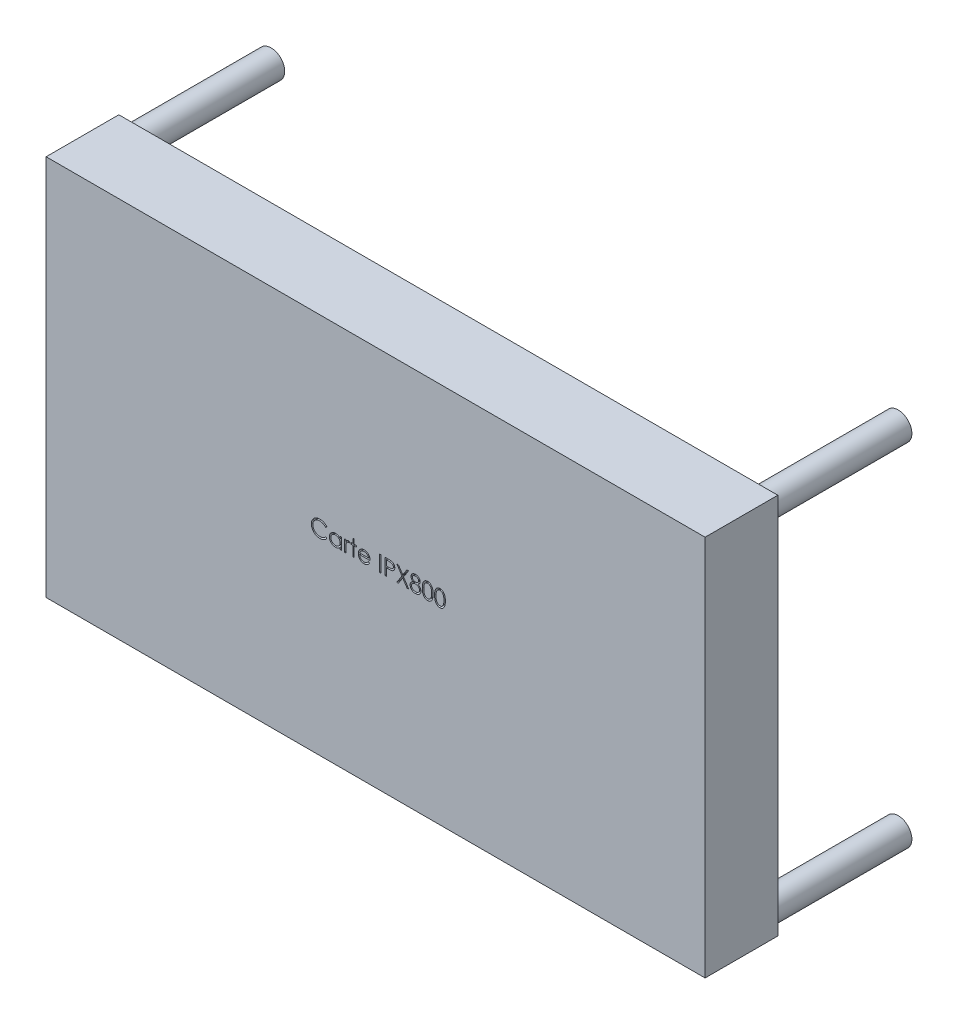
from build123d import *

# Parameters (mm, degrees)
ESQUISSE1_W          = 145
ESQUISSE1_H          = 84
EXTRUSION1_DEPTH     = 16
ESQUISSE2_R          = 3
EXTRUSION2_DEPTH     = 30
EXTRUSION3_START     = 14
EXTRUSION3_OUTLINE_W = 0.314102564
EXTRUSION3_OUTLINE_H = 3.5
EXTRUSION3_DEPTH     = 2


# Read off the part's stored shape, not the designer's step: Extrusion3
with BuildPart() as part:
    # Esquisse1 → Extrusion1 (new body)
    with BuildSketch(Plane.XY):
        with Locations((72.5, -42)):
            Rectangle(ESQUISSE1_W, ESQUISSE1_H)
    extrude(amount=EXTRUSION1_DEPTH)

    # Esquisse2 → Extrusion2 (add)
    with BuildSketch(Plane(origin=(0, 0, 0), x_dir=(-1, 0, 0), z_dir=(0, 0, -1))):
        with Locations(Location((-141.5, -3.5, 0), (0, 0, 180))):
            Circle(ESQUISSE2_R)
        with Locations(Location((-3.5, -3.5, 0), (0, 0, 180))):
            Circle(ESQUISSE2_R)
        with Locations(Location((-3.5, -80.5, 0), (0, 0, 180))):
            Circle(ESQUISSE2_R)
        with Locations(Location((-141.5, -80.807682255, 0), (0, 0, 180))):
            Circle(ESQUISSE2_R)
    extrude(amount=EXTRUSION2_DEPTH)

    # Extrusion3 outline → Extrusion3 (cut)
    # profile 1 of 11: a face of its own
    with BuildSketch(Plane.XY.offset(EXTRUSION3_START)):
        with BuildLine():
            add(Edge.make_bspline(
                [(60.256052199, -38.932405332), (60.296266671, -38.932887471), (60.375867168, -38.933841815), (60.49361982, -38.943147957), (60.608262147, -38.958661563), (60.719873129, -38.979777633), (60.828995745, -39.005984954), (60.934795986, -39.040125253), (61.037894673, -39.079161784), (61.137641581, -39.12412025), (61.233558132, -39.174586991), (61.32561445, -39.230002615), (61.413079309, -39.29029842), (61.496568157, -39.354961596), (61.574684368, -39.425360155), (61.649645847, -39.499557751), (61.718906925, -39.579691575), (61.76166012, -39.636096509), (61.783095468, -39.664376486)],
                knots=[0, 0, 0, 0, 0.068547537, 0.135682946, 0.20121499, 0.265682235, 0.329266835, 0.392395428, 0.455069762, 0.51712685, 0.578790035, 0.639739863, 0.700191504, 0.759806243, 0.819628319, 0.879354791, 0.939511608, 1, 1, 1, 1], degree=3))
            add(Edge.make_bspline(
                [(58.372839058, -40.75181639), (58.374394251, -40.688860937), (58.377453997, -40.565000012), (58.403449793, -40.383226059), (58.445268589, -40.20907466), (58.504665478, -40.042870915), (58.579970829, -39.883740635), (58.672997443, -39.73289943), (58.782664585, -39.589382631), (58.908112153, -39.455367879), (59.045679488, -39.332828527), (59.192998302, -39.225022323), (59.349780249, -39.135304807), (59.514298101, -39.060308644), (59.687783782, -39.002664181), (59.869867151, -38.962310995), (60.060206066, -38.937193878), (60.190068492, -38.93401867), (60.256052199, -38.932405332)],
                knots=[0, 0, 0, 0, 0.064557846, 0.127013532, 0.18795481, 0.248013913, 0.307747682, 0.368234515, 0.429469844, 0.492743437, 0.556257769, 0.618216786, 0.679655476, 0.741245546, 0.803415265, 0.866815462, 0.932328312, 1, 1, 1, 1], degree=3))
            add(Edge.make_bspline(
                [(58.816649154, -41.999813185), (58.78121351, -41.956271996), (58.710770033, -41.869715286), (58.62064435, -41.729429304), (58.543496795, -41.582961096), (58.481120874, -41.429541167), (58.432358141, -41.26951378), (58.398576946, -41.102798265), (58.376625341, -40.929550323), (58.374115052, -40.811713534), (58.372839058, -40.75181639)],
                knots=[0, 0, 0, 0, 0.12432851, 0.247156016, 0.368779749, 0.490733862, 0.613613772, 0.738957576, 0.867310575, 1, 1, 1, 1], degree=3))
            add(Edge.make_bspline(
                [(60.260258929, -42.611892512), (60.222615262, -42.611630519), (60.148179572, -42.611112462), (60.038280821, -42.602720294), (59.93129124, -42.591270557), (59.827516614, -42.574030426), (59.726390639, -42.553686086), (59.628830054, -42.526414829), (59.533874844, -42.495865663), (59.441906503, -42.459960676), (59.352846804, -42.419444494), (59.266982992, -42.373652935), (59.18435456, -42.32297107), (59.104149139, -42.26851606), (59.027551555, -42.208538758), (58.95389803, -42.143872123), (58.882775554, -42.074734112), (58.838772869, -42.024879259), (58.816649154, -41.999813185)],
                knots=[0, 0, 0, 0, 0.069662801, 0.137749562, 0.203916744, 0.268779862, 0.332413706, 0.39475354, 0.456180032, 0.516995649, 0.577395938, 0.637198344, 0.696999184, 0.756756194, 0.816553905, 0.876947997, 0.938131788, 1, 1, 1, 1], degree=3))
            add(Edge.make_bspline(
                [(61.783095468, -41.877817993), (61.760977358, -41.906356445), (61.716847083, -41.963296651), (61.645389066, -42.043568361), (61.570111768, -42.119072396), (61.490456058, -42.189200017), (61.407338267, -42.255354483), (61.319265954, -42.315656314), (61.227396922, -42.370947199), (61.132042443, -42.421574123), (61.03330383, -42.46649137), (60.931299395, -42.504945138), (60.82646882, -42.538070027), (60.718807311, -42.565321964), (60.608091554, -42.586593048), (60.49472108, -42.600812723), (60.378451205, -42.610554637), (60.300009784, -42.611442553), (60.260258929, -42.611892512)],
                knots=[0, 0, 0, 0, 0.061674239, 0.123053062, 0.183475001, 0.243726501, 0.304278917, 0.364862921, 0.425946204, 0.48739123, 0.549220384, 0.611143589, 0.67352853, 0.736961457, 0.800785283, 0.866012596, 0.932100748, 1, 1, 1, 1], degree=3))
            Line((61.783095468, -41.877817993), (61.508255724, -41.66958482))
            add(Edge.make_bspline(
                [(60.258155564, -42.252918153), (60.319258253, -42.251229373), (60.439522962, -42.247905451), (60.615890988, -42.219746202), (60.784726754, -42.174088284), (60.94603934, -42.110190361), (61.099373987, -42.027125073), (61.244970647, -41.926427196), (61.382952217, -41.807138863), (61.4659235, -41.716055735), (61.508255724, -41.66958482)],
                knots=[0, 0, 0, 0, 0.12851519, 0.252948636, 0.374754734, 0.495939754, 0.617180641, 0.740909469, 0.867811148, 1, 1, 1, 1], degree=3))
            add(Edge.make_bspline(
                [(58.686941622, -40.775654531), (58.688203441, -40.827385851), (58.690680855, -40.928953436), (58.712729189, -41.077724046), (58.74623428, -41.22024472), (58.796449857, -41.355624563), (58.858368908, -41.485532921), (58.936609519, -41.607771774), (59.027226057, -41.724188339), (59.131500476, -41.832031286), (59.245906292, -41.930545012), (59.368654204, -42.017295593), (59.499438492, -42.089610476), (59.636815122, -42.149786422), (59.781841236, -42.19604315), (59.934256038, -42.228607273), (60.093728033, -42.249849454), (60.202697433, -42.251883142), (60.258155564, -42.252918153)],
                knots=[0, 0, 0, 0, 0.064323217, 0.126290104, 0.186726469, 0.246146432, 0.305575643, 0.365429386, 0.426326309, 0.488839906, 0.551724972, 0.613918596, 0.675483766, 0.737333897, 0.800229044, 0.864502298, 0.931040739, 1, 1, 1, 1], degree=3))
            add(Edge.make_bspline(
                [(60.236420788, -39.291379691), (60.201337489, -39.291783654), (60.131496496, -39.29258783), (60.027848023, -39.303196955), (59.926134972, -39.318108165), (59.826423506, -39.340233488), (59.728840547, -39.368206107), (59.632748145, -39.401631521), (59.539537545, -39.442986361), (59.447919307, -39.488694621), (59.360140096, -39.540322066), (59.277085048, -39.596635418), (59.19905708, -39.657004514), (59.125994468, -39.721655621), (59.05782252, -39.790297581), (58.995035209, -39.863661923), (58.937849799, -39.941514096), (58.885132774, -40.022827504), (58.83792004, -40.107365295), (58.798390161, -40.195440366), (58.763385039, -40.285544469), (58.735685796, -40.37869563), (58.713761279, -40.474238395), (58.698633616, -40.572429183), (58.688145145, -40.673062863), (58.687344968, -40.741272176), (58.686941622, -40.775654531)],
                knots=[0, 0, 0, 0, 0.043954909, 0.087501875, 0.130462627, 0.172752021, 0.215403067, 0.25764983, 0.300152749, 0.34312149, 0.385925163, 0.427685727, 0.46881795, 0.5094918, 0.549883031, 0.589980023, 0.63040523, 0.670868626, 0.711383944, 0.751627258, 0.791775577, 0.832458919, 0.873319045, 0.914542956, 0.956923558, 1, 1, 1, 1], degree=3))
            add(Edge.make_bspline(
                [(61.508255724, -39.874713025), (61.488649836, -39.851347055), (61.449702389, -39.804930139), (61.387043187, -39.739750595), (61.321741544, -39.678685333), (61.253822422, -39.621443454), (61.182063303, -39.570026688), (61.108202504, -39.521755585), (61.031004459, -39.478487847), (60.924252724, -39.426024861), (60.784604876, -39.371278706), (60.608810037, -39.325375475), (60.425298939, -39.296154299), (60.300101339, -39.292989457), (60.236420788, -39.291379691)],
                knots=[0, 0, 0, 0, 0.063163259, 0.125474941, 0.18712122, 0.248294346, 0.309294856, 0.369850066, 0.430973376, 0.49245599, 0.616147966, 0.740843698, 0.868182649, 1, 1, 1, 1], degree=3))
            Line((61.508255724, -39.874713025), (61.783095468, -39.664376486))
        make_face()
    # profile 2 of 11: a face of its own
    with BuildSketch(Plane.XY.offset(EXTRUSION3_START)):
        with BuildLine():
            add(Edge.make_bspline(
                [(64.699762135, -42.07974107), (64.664343344, -42.119780664), (64.595223129, -42.197918435), (64.479782011, -42.300000607), (64.357413833, -42.384378929), (64.228712512, -42.452528844), (64.093794268, -42.503720901), (63.952958181, -42.54010706), (63.8061468, -42.563500895), (63.705894445, -42.565836917), (63.65509066, -42.567020717)],
                knots=[0, 0, 0, 0, 0.134298379, 0.262084975, 0.386269912, 0.507164597, 0.627300236, 0.748144942, 0.872370177, 1, 1, 1, 1], degree=3))
            Line((64.699762135, -42.07974107), (64.699762135, -42.522148922))
            Line((64.699762135, -42.522148922), (65.013864699, -42.522148922))
            Line((65.013864699, -42.522148922), (65.013864699, -39.964456614))
            Line((65.013864699, -39.964456614), (64.699762135, -39.964456614))
            Line((64.699762135, -39.964456614), (64.699762135, -40.437713826))
            add(Edge.make_bspline(
                [(63.664906365, -39.91958482), (63.717106224, -39.921022571), (63.819467684, -39.923841934), (63.969195694, -39.947304661), (64.110840172, -39.986943129), (64.245494524, -40.040860627), (64.37267521, -40.112509356), (64.491178194, -40.202889317), (64.602243677, -40.311430504), (64.666623969, -40.394800948), (64.699762135, -40.437713826)],
                knots=[0, 0, 0, 0, 0.129862142, 0.254653531, 0.376014554, 0.495255252, 0.614797719, 0.738105554, 0.8651963, 1, 1, 1, 1], degree=3))
            add(Edge.make_bspline(
                [(62.321557006, -41.23629155), (62.322809978, -41.191827847), (62.325287035, -41.103925503), (62.343740254, -40.974646806), (62.374771263, -40.850128545), (62.418319111, -40.730771602), (62.474161066, -40.616431551), (62.542089153, -40.507027526), (62.622108277, -40.402258129), (62.714360684, -40.304586902), (62.814295455, -40.214366288), (62.921204185, -40.135957242), (63.032427467, -40.068240394), (63.149690477, -40.014586917), (63.271257582, -39.971177813), (63.398211028, -39.941144845), (63.530022607, -39.923447523), (63.619513099, -39.920884759), (63.664906365, -39.91958482)],
                knots=[0, 0, 0, 0, 0.063774532, 0.12607881, 0.186904093, 0.247573935, 0.308003356, 0.369131898, 0.432033228, 0.496790794, 0.561610823, 0.624913866, 0.686726349, 0.748078833, 0.809582291, 0.871630743, 0.934885821, 1, 1, 1, 1], degree=3))
            add(Edge.make_bspline(
                [(63.65509066, -42.567020717), (63.609922706, -42.565794345), (63.520849501, -42.563375884), (63.389820424, -42.544613581), (63.263728175, -42.514482959), (63.142453602, -42.47258207), (63.026781457, -42.417001248), (62.91572136, -42.35046), (62.809848668, -42.27121917), (62.710777129, -42.180631142), (62.619545129, -42.082236154), (62.539483856, -41.977290607), (62.472730776, -41.866248304), (62.416910696, -41.75051515), (62.373914351, -41.62920023), (62.343940717, -41.502723062), (62.32520027, -41.371233189), (62.322782809, -41.281693666), (62.321557006, -41.23629155)],
                knots=[0, 0, 0, 0, 0.064619991, 0.127433484, 0.189004127, 0.249930071, 0.310668454, 0.372328961, 0.43493911, 0.499575544, 0.564191208, 0.626735217, 0.688109334, 0.749293607, 0.810330528, 0.87190117, 0.935045915, 1, 1, 1, 1], degree=3))
        make_face()
        with BuildLine():
            add(Edge.make_bspline(
                [(64.699762135, -41.248911743), (64.698802478, -41.213573912), (64.696913571, -41.144017879), (64.682483001, -41.041890361), (64.659528075, -40.944156635), (64.627181905, -40.850713946), (64.58469062, -40.762078931), (64.533442854, -40.677615171), (64.472537405, -40.597761959), (64.402954709, -40.523618888), (64.326789506, -40.455992426), (64.246194965, -40.395628185), (64.160216218, -40.346039412), (64.070299182, -40.304998141), (63.976287847, -40.272338991), (63.877417227, -40.250551297), (63.77473824, -40.235590976), (63.704692185, -40.234328596), (63.669113096, -40.233687384)],
                knots=[0, 0, 0, 0, 0.0656338, 0.129188088, 0.191218683, 0.251912818, 0.312507474, 0.373494434, 0.4351516, 0.498741474, 0.562095217, 0.624186567, 0.685475718, 0.746096815, 0.807611636, 0.869966581, 0.933951019, 1, 1, 1, 1], degree=3))
            add(Edge.make_bspline(
                [(63.666308609, -42.252918153), (63.711755112, -42.251258189), (63.802143698, -42.247956685), (63.935582406, -42.22267542), (64.065077369, -42.180906622), (64.188864597, -42.123007495), (64.304180728, -42.051250139), (64.407678606, -41.967243048), (64.495194574, -41.869539864), (64.569387184, -41.762163411), (64.627562601, -41.644451414), (64.66993866, -41.519117224), (64.694992566, -41.386156476), (64.698150295, -41.295292549), (64.699762135, -41.248911743)],
                knots=[0, 0, 0, 0, 0.084802388, 0.16866354, 0.252551924, 0.338239689, 0.423102661, 0.505556051, 0.586175656, 0.66713572, 0.74849918, 0.830452399, 0.913455706, 1, 1, 1, 1], degree=3))
            add(Edge.make_bspline(
                [(62.63565957, -41.239797159), (62.637524464, -41.283387267), (62.641246941, -41.370396622), (62.667997635, -41.499377199), (62.712877508, -41.625031241), (62.774119571, -41.746292235), (62.850806196, -41.858876335), (62.939694848, -41.960616458), (63.04164513, -42.048106046), (63.154572637, -42.12134362), (63.275180607, -42.18050614), (63.402014539, -42.22167178), (63.532690177, -42.248249561), (63.621542511, -42.251354037), (63.666308609, -42.252918153)],
                knots=[0, 0, 0, 0, 0.081589349, 0.162858895, 0.245483689, 0.330807139, 0.416493374, 0.499893203, 0.583048156, 0.667157852, 0.751311929, 0.833784789, 0.916256489, 1, 1, 1, 1], degree=3))
            add(Edge.make_bspline(
                [(63.669113096, -40.233687384), (63.623198758, -40.235321021), (63.532571158, -40.238545562), (63.399527156, -40.263719058), (63.272213742, -40.305603652), (63.151267668, -40.362885553), (63.038599451, -40.43491429), (62.93790578, -40.522035673), (62.848363079, -40.621872687), (62.773054815, -40.733974798), (62.711664318, -40.854152889), (62.668497286, -40.979777327), (62.640028038, -41.108582304), (62.637119518, -41.19594499), (62.63565957, -41.239797159)],
                knots=[0, 0, 0, 0, 0.085920517, 0.169593435, 0.252475515, 0.336244477, 0.419504521, 0.502035907, 0.584774648, 0.669846475, 0.754184866, 0.836658238, 0.918009726, 1, 1, 1, 1], degree=3))
        make_face(mode=Mode.SUBTRACT)
    # profile 3 of 11: a face of its own
    with BuildSketch(Plane.XY.offset(EXTRUSION3_START)):
        with BuildLine():
            add(Edge.make_bspline(
                [(65.956172391, -40.340959018), (65.97936115, -40.30590319), (66.023709471, -40.238859191), (66.0974224, -40.15018989), (66.172925731, -40.076774843), (66.250580919, -40.018271324), (66.330959018, -39.974458206), (66.41229597, -39.94236517), (66.49587144, -39.923387855), (66.552033364, -39.920854196), (66.580170788, -39.91958482)],
                knots=[0, 0, 0, 0, 0.160059412, 0.306112383, 0.438366514, 0.560541455, 0.675317225, 0.786113634, 0.892841788, 1, 1, 1, 1], degree=3))
            Line((65.956172391, -40.340959018), (65.956172391, -39.964456614))
            Line((65.956172391, -39.964456614), (65.642069827, -39.964456614))
            Line((65.642069827, -39.964456614), (65.642069827, -42.522148922))
            Line((65.642069827, -42.522148922), (65.956172391, -42.522148922))
            Line((65.956172391, -42.522148922), (65.956172391, -41.662573602))
            add(Edge.make_bspline(
                [(66.012262135, -40.784769114), (66.007529741, -40.805046288), (65.997047849, -40.849958687), (65.986856312, -40.925307211), (65.976786794, -41.01433087), (65.969690175, -41.117277463), (65.963112133, -41.233889907), (65.959402051, -41.364345853), (65.95629891, -41.508779204), (65.956215844, -41.609753557), (65.956172391, -41.662573602)],
                knots=[0, 0, 0, 0, 0.070854869, 0.15693815, 0.258600395, 0.37589093, 0.508166168, 0.656237809, 0.82017677, 1, 1, 1, 1], degree=3))
            add(Edge.make_bspline(
                [(66.520575436, -40.233687384), (66.495369702, -40.235367421), (66.443957312, -40.23879421), (66.368472813, -40.265733018), (66.295225607, -40.309258258), (66.237053945, -40.35752937), (66.192011692, -40.404077168), (66.159871467, -40.44472557), (66.13038872, -40.490304202), (66.102218499, -40.540033885), (66.076552205, -40.594763731), (66.052597536, -40.653946945), (66.030938673, -40.717652074), (66.018588429, -40.762034594), (66.012262135, -40.784769114)],
                knots=[0, 0, 0, 0, 0.093806529, 0.191338128, 0.295190617, 0.410312337, 0.471930251, 0.536425159, 0.603118728, 0.674117672, 0.749332023, 0.828283384, 0.912039809, 1, 1, 1, 1], degree=3))
            add(Edge.make_bspline(
                [(66.681132327, -40.2792603), (66.666023306, -40.272520034), (66.637343491, -40.259725719), (66.595388925, -40.244583709), (66.556707588, -40.235667793), (66.53206403, -40.234317075), (66.520575436, -40.233687384)],
                knots=[0, 0, 0, 0, 0.295138801, 0.560229945, 0.794983357, 1, 1, 1, 1], degree=3))
            Line((66.681132327, -40.2792603), (66.853608288, -40.007225044))
            add(Edge.make_bspline(
                [(66.580170788, -39.91958482), (66.601997115, -39.920775346), (66.6469062, -39.923224932), (66.71488879, -39.940435757), (66.784932242, -39.967913779), (66.830074629, -39.993754002), (66.853608288, -40.007225044)],
                knots=[0, 0, 0, 0, 0.225277548, 0.463523195, 0.720323555, 1, 1, 1, 1], degree=3))
        make_face()
    # profile 4 of 11: a face of its own
    with BuildSketch(Plane.XY.offset(EXTRUSION3_START)):
        with BuildLine():
            add(Edge.make_bspline(
                [(69.940647551, -42.252918153), (69.971998699, -42.252310096), (70.03420539, -42.251103595), (70.126846247, -42.239371684), (70.217985774, -42.220401409), (70.307246758, -42.194511419), (70.392817604, -42.162934567), (70.472063154, -42.124831709), (70.544943369, -42.082681962), (70.613060336, -42.034472287), (70.679131329, -41.9754641), (70.744673816, -41.901828379), (70.814950469, -41.814740851), (70.858940062, -41.749195185), (70.882254122, -41.714456614)],
                knots=[0, 0, 0, 0, 0.082592263, 0.163878894, 0.24565874, 0.327725695, 0.408609961, 0.485749086, 0.559169056, 0.630268476, 0.705306028, 0.792064966, 0.889796437, 1, 1, 1, 1], degree=3))
            add(Edge.make_bspline(
                [(69.007454442, -41.310610461), (69.008994049, -41.344310925), (69.012021623, -41.410581529), (69.026136766, -41.507552312), (69.04838554, -41.599925654), (69.079654602, -41.687008696), (69.117521447, -41.769938823), (69.163907164, -41.84810086), (69.219246718, -41.92113879), (69.280972418, -41.989705928), (69.349679513, -42.050766689), (69.42196226, -42.105418465), (69.498855825, -42.151224062), (69.579753909, -42.188403952), (69.664525694, -42.217510268), (69.753197889, -42.237378089), (69.845596005, -42.250685195), (69.908581739, -42.252164861), (69.940647551, -42.252918153)],
                knots=[0, 0, 0, 0, 0.068384615, 0.134475588, 0.198391058, 0.260753477, 0.321829223, 0.383037238, 0.444653123, 0.507398011, 0.569825238, 0.630777641, 0.690928687, 0.750945133, 0.811049477, 0.872330853, 0.935004094, 1, 1, 1, 1], degree=3))
            Line((69.007454442, -41.310610461), (71.295915981, -41.310610461))
            add(Edge.make_bspline(
                [(71.017570628, -40.422990268), (71.039697566, -40.45319385), (71.08380416, -40.513399968), (71.13905126, -40.611571126), (71.187008655, -40.71428172), (71.225341616, -40.823192017), (71.256381117, -40.937011597), (71.278837935, -41.056554142), (71.292007554, -41.181784053), (71.294596251, -41.267110609), (71.295915981, -41.310610461)],
                knots=[0, 0, 0, 0, 0.11852184, 0.236254763, 0.356174434, 0.477249655, 0.601539871, 0.729618382, 0.862158266, 1, 1, 1, 1], degree=3))
            add(Edge.make_bspline(
                [(69.987622711, -39.91958482), (70.040070317, -39.920938869), (70.142960563, -39.923595204), (70.292992684, -39.948221537), (70.4349534, -39.987274092), (70.568785905, -40.042427882), (70.694503765, -40.113587434), (70.811289815, -40.201729276), (70.921141327, -40.304147363), (70.985049906, -40.382910572), (71.017570628, -40.422990268)],
                knots=[0, 0, 0, 0, 0.132040234, 0.259032841, 0.381879824, 0.502258444, 0.62275219, 0.744742632, 0.870108927, 1, 1, 1, 1], degree=3))
            add(Edge.make_bspline(
                [(68.987823032, -40.39634764), (69.019530715, -40.35847877), (69.081941661, -40.28394062), (69.187498017, -40.186002294), (69.301798213, -40.103958519), (69.423409839, -40.035951382), (69.553746313, -39.984277736), (69.691055604, -39.945770153), (69.83690119, -39.924192142), (69.936606411, -39.921144309), (69.987622711, -39.91958482)],
                knots=[0, 0, 0, 0, 0.128835254, 0.253589335, 0.374643257, 0.495340042, 0.616324775, 0.739759335, 0.86684232, 1, 1, 1, 1], degree=3))
            add(Edge.make_bspline(
                [(68.693351878, -41.250313986), (68.694411019, -41.211019156), (68.696510098, -41.133141991), (68.709740885, -41.017876447), (68.733189178, -40.905847994), (68.765365502, -40.796963546), (68.806916748, -40.691405412), (68.857748967, -40.589109349), (68.917941345, -40.490184209), (68.964414019, -40.427781075), (68.987823032, -40.39634764)],
                knots=[0, 0, 0, 0, 0.128044808, 0.2537679, 0.377428427, 0.500550841, 0.623295883, 0.746578332, 0.872347541, 1, 1, 1, 1], degree=3))
            add(Edge.make_bspline(
                [(69.979910372, -42.567020717), (69.930768394, -42.565873542), (69.834906633, -42.563635735), (69.695366885, -42.544343271), (69.563987467, -42.512870912), (69.440775764, -42.46890537), (69.326033511, -42.411478046), (69.219532656, -42.341518564), (69.12071313, -42.25938631), (69.032688921, -42.164369866), (68.953445038, -42.062687909), (68.883519219, -41.956732025), (68.825061787, -41.8467688), (68.777509177, -41.733498276), (68.739104312, -41.617634382), (68.712337609, -41.498122915), (68.696907861, -41.375287331), (68.694543415, -41.292189995), (68.693351878, -41.250313986)],
                knots=[0, 0, 0, 0, 0.071578658, 0.139629225, 0.204796697, 0.268134963, 0.329813747, 0.391301398, 0.453433515, 0.51655169, 0.579631271, 0.641118921, 0.701294047, 0.760810336, 0.819931722, 0.878919575, 0.938982822, 1, 1, 1, 1], degree=3))
            add(Edge.make_bspline(
                [(71.161300596, -41.86099107), (71.139064001, -41.900434401), (71.095800392, -41.977175504), (71.021399644, -42.082607364), (70.943407572, -42.17745508), (70.858303604, -42.259184734), (70.768633925, -42.330436119), (70.67390127, -42.392773944), (70.573612452, -42.445892464), (70.467762728, -42.490644992), (70.355463176, -42.525054486), (70.23644166, -42.549358707), (70.110470165, -42.564381976), (70.024123985, -42.566127117), (69.979910372, -42.567020717)],
                knots=[0, 0, 0, 0, 0.093369857, 0.181660766, 0.265874227, 0.346354784, 0.424599862, 0.501903184, 0.579992091, 0.658443431, 0.738672236, 0.821894148, 0.908800792, 1, 1, 1, 1], degree=3))
            Line((71.161300596, -41.86099107), (70.882254122, -41.714456614))
        make_face()
        with BuildLine():
            add(Edge.make_bspline(
                [(69.344694026, -40.473471038), (69.328000744, -40.488565353), (69.294217609, -40.519112569), (69.249077088, -40.571741776), (69.205856615, -40.628493338), (69.166522962, -40.691538463), (69.130445376, -40.760159242), (69.096685399, -40.833776877), (69.066298987, -40.912950007), (69.049202877, -40.968122446), (69.040407167, -40.996507897)],
                knots=[0, 0, 0, 0, 0.109983845, 0.222580497, 0.338499871, 0.458708565, 0.585535346, 0.717517743, 0.85466682, 1, 1, 1, 1], degree=3))
            add(Edge.make_bspline(
                [(70.003748513, -40.233687384), (69.972399074, -40.234299055), (69.910427825, -40.235508201), (69.819126757, -40.246978331), (69.731447058, -40.265938176), (69.64674177, -40.291903132), (69.566120902, -40.326511735), (69.487926134, -40.367094961), (69.414145738, -40.416636545), (69.368004442, -40.4543954), (69.344694026, -40.473471038)],
                knots=[0, 0, 0, 0, 0.131091976, 0.259141276, 0.384161763, 0.505991952, 0.629098089, 0.750669123, 0.874038938, 1, 1, 1, 1], degree=3))
            add(Edge.make_bspline(
                [(70.981813417, -40.996507897), (70.970316792, -40.954845023), (70.948189491, -40.874657402), (70.901953126, -40.763616512), (70.849881585, -40.664928611), (70.788259854, -40.579348978), (70.718441128, -40.503345465), (70.637795946, -40.43692688), (70.547360052, -40.377509429), (70.447600912, -40.327356929), (70.341959126, -40.28466707), (70.231352935, -40.256041955), (70.118495147, -40.236432412), (70.04216086, -40.234606304), (70.003748513, -40.233687384)],
                knots=[0, 0, 0, 0, 0.096240125, 0.185231261, 0.267500523, 0.344400382, 0.419594869, 0.496890627, 0.576637919, 0.660267852, 0.745386615, 0.830040327, 0.914474212, 1, 1, 1, 1], degree=3))
            Line((70.981813417, -40.996507897), (69.040407167, -40.996507897))
        make_face(mode=Mode.SUBTRACT)
    # profile 5 of 11: a face of its own
    with BuildSketch(Plane.XY.offset(EXTRUSION3_START)):
        with BuildLine():
            add(Edge.make_bspline(
                [(75.257955243, -39.022148922), (75.30516615, -39.022200818), (75.395624342, -39.022300254), (75.525339398, -39.025315), (75.64314913, -39.029341692), (75.748799511, -39.034923585), (75.842615609, -39.041520175), (75.924172908, -39.050772215), (75.994112465, -39.06043251), (76.036018914, -39.070253917), (76.055130724, -39.074733057)],
                knots=[0, 0, 0, 0, 0.176955752, 0.33905508, 0.486318225, 0.618780923, 0.735618828, 0.838742477, 0.926457068, 1, 1, 1, 1], degree=3))
            Line((75.257955243, -39.022148922), (74.571557006, -39.022148922))
            Line((74.571557006, -39.022148922), (74.571557006, -42.522148922))
            Line((74.571557006, -42.522148922), (74.88565957, -42.522148922))
            Line((74.88565957, -42.522148922), (74.88565957, -40.906764307))
            Line((74.88565957, -40.906764307), (75.135960051, -40.906764307))
            add(Edge.make_bspline(
                [(76.027085852, -40.84927232), (76.005158518, -40.853935301), (75.957103491, -40.864154495), (75.877960769, -40.875562952), (75.785815383, -40.885300552), (75.680793103, -40.89260169), (75.562988198, -40.898852058), (75.432336941, -40.903820152), (75.288582864, -40.906550006), (75.18831162, -40.906690799), (75.135960051, -40.906764307)],
                knots=[0, 0, 0, 0, 0.075173117, 0.164746258, 0.268016881, 0.385911876, 0.517789479, 0.663690977, 0.824413221, 1, 1, 1, 1], degree=3))
            add(Edge.make_bspline(
                [(76.72540316, -39.960951006), (76.724981735, -39.989728782), (76.724157189, -40.046034446), (76.714260904, -40.128407234), (76.700930713, -40.207125625), (76.68043366, -40.282015075), (76.653587987, -40.352630846), (76.622095934, -40.420052078), (76.584112404, -40.483131749), (76.540467574, -40.542098867), (76.49191598, -40.597008779), (76.438663042, -40.647463574), (76.380923749, -40.693167912), (76.318881601, -40.734224256), (76.251931752, -40.769680535), (76.181089599, -40.80143784), (76.105739382, -40.828108901), (76.053596868, -40.842138962), (76.027085852, -40.84927232)],
                knots=[0, 0, 0, 0, 0.070118894, 0.137192353, 0.202016181, 0.264631407, 0.326116547, 0.386010305, 0.445811847, 0.505297697, 0.564633278, 0.624282625, 0.683902032, 0.743952771, 0.805387731, 0.868388031, 0.933084028, 1, 1, 1, 1], degree=3))
            add(Edge.make_bspline(
                [(76.055130724, -39.074733057), (76.079324258, -39.081355007), (76.127141235, -39.094442868), (76.196042278, -39.120656592), (76.261596124, -39.151738757), (76.324027682, -39.187162697), (76.382569765, -39.228448261), (76.438095806, -39.273921879), (76.490115787, -39.324633447), (76.538337179, -39.380014187), (76.582621976, -39.439134397), (76.620751659, -39.502876627), (76.652678886, -39.57016793), (76.680062157, -39.640961502), (76.699770612, -39.715851825), (76.714617512, -39.794318537), (76.724041139, -39.876353228), (76.724943701, -39.932413095), (76.72540316, -39.960951006)],
                knots=[0, 0, 0, 0, 0.062481339, 0.123490383, 0.183411094, 0.243153221, 0.302126735, 0.361709671, 0.421842292, 0.482931901, 0.544552254, 0.60568072, 0.667679738, 0.729984388, 0.794550921, 0.86034562, 0.928907356, 1, 1, 1, 1], degree=3))
        make_face()
        with BuildLine():
            add(Edge.make_bspline(
                [(76.411300596, -39.962353249), (76.41003795, -39.934214736), (76.407527965, -39.878278854), (76.388872101, -39.796300093), (76.357522788, -39.718064389), (76.314066193, -39.645091303), (76.261325063, -39.578902499), (76.20002572, -39.521405372), (76.130312459, -39.475183669), (76.065464228, -39.445350388), (76.007863042, -39.427135112), (75.957831082, -39.414390272), (75.901340407, -39.404214666), (75.838372628, -39.395975163), (75.769415794, -39.388921702), (75.693877479, -39.384135724), (75.612043836, -39.381334268), (75.555233265, -39.381195313), (75.525783769, -39.381123281)],
                knots=[0, 0, 0, 0, 0.070043755, 0.139238317, 0.208197455, 0.279173374, 0.349986812, 0.418353846, 0.487609584, 0.557411073, 0.595330157, 0.637964052, 0.685912778, 0.738185165, 0.796102647, 0.858516544, 0.926657726, 1, 1, 1, 1], degree=3))
            add(Edge.make_bspline(
                [(75.498440019, -40.555502288), (75.528359945, -40.555517751), (75.586119745, -40.555547603), (75.669555968, -40.55156238), (75.746965255, -40.546961847), (75.818109831, -40.540225924), (75.883021765, -40.530704666), (75.941809294, -40.521092928), (75.994016577, -40.507187566), (76.055115779, -40.488464497), (76.123199126, -40.456531881), (76.197266675, -40.410181991), (76.260037261, -40.351101283), (76.314355558, -40.284673451), (76.357461436, -40.210774322), (76.389017428, -40.131705385), (76.407558586, -40.048277536), (76.410044779, -39.991189397), (76.411300596, -39.962353249)],
                knots=[0, 0, 0, 0, 0.072538371, 0.140033831, 0.202495681, 0.260575056, 0.313228338, 0.361583194, 0.404878361, 0.444127437, 0.516399693, 0.586506671, 0.655085374, 0.724383783, 0.793973529, 0.861637682, 0.930110942, 1, 1, 1, 1], degree=3))
            Line((75.498440019, -40.555502288), (74.88565957, -40.547789948))
            Line((74.88565957, -40.547789948), (74.88565957, -39.381123281))
            Line((74.88565957, -39.381123281), (75.525783769, -39.381123281))
        make_face(mode=Mode.SUBTRACT)
    # profile 6 of 11: a face of its own
    with BuildSketch(Plane.XY.offset(EXTRUSION3_START)):
        with BuildLine():
            add(Edge.make_bspline(
                [(82.289505724, -39.840358057), (82.288071164, -39.878334721), (82.285253768, -39.95291873), (82.261553829, -40.06164525), (82.221640515, -40.163467289), (82.167146352, -40.259540242), (82.096120864, -40.348121739), (82.009512131, -40.430338209), (81.908010653, -40.506865037), (81.831749767, -40.550051402), (81.792410372, -40.572329211)],
                knots=[0, 0, 0, 0, 0.121904041, 0.239412608, 0.355410104, 0.472090729, 0.592858982, 0.718703468, 0.854892383, 1, 1, 1, 1], degree=3))
            add(Edge.make_bspline(
                [(81.296016141, -38.932405332), (81.340519956, -38.933851676), (81.428276409, -38.936703699), (81.557271037, -38.960490577), (81.680695914, -39.000220097), (81.798125413, -39.054117321), (81.90745728, -39.120504261), (82.00405959, -39.200905135), (82.089392172, -39.291046686), (82.159976566, -39.391966289), (82.218139455, -39.498650483), (82.258640356, -39.610273004), (82.28459233, -39.724422063), (82.287865695, -39.801660067), (82.289505724, -39.840358057)],
                knots=[0, 0, 0, 0, 0.089409711, 0.176305764, 0.262625902, 0.349445726, 0.435498264, 0.51892813, 0.601354657, 0.684256422, 0.76580674, 0.844876866, 0.922279795, 1, 1, 1, 1], degree=3))
            add(Edge.make_bspline(
                [(80.270274955, -39.830542352), (80.271910379, -39.793244793), (80.275197867, -39.718270196), (80.301781187, -39.606664073), (80.345101254, -39.497047508), (80.404022251, -39.389951795), (80.477409467, -39.289001581), (80.565456013, -39.198460634), (80.66605931, -39.119149152), (80.778717177, -39.052572979), (80.899953412, -38.99838932), (81.027869136, -38.961010897), (81.160235629, -38.936574781), (81.250333349, -38.933808126), (81.296016141, -38.932405332)],
                knots=[0, 0, 0, 0, 0.074058426, 0.148870352, 0.226667668, 0.307734759, 0.391157204, 0.473929356, 0.557927752, 0.64498929, 0.733364056, 0.821092042, 0.909287215, 1, 1, 1, 1], degree=3))
            add(Edge.make_bspline(
                [(80.781392743, -40.572329211), (80.740801369, -40.550194442), (80.662205106, -40.507335334), (80.558135665, -40.428588528), (80.468745041, -40.343300714), (80.396490324, -40.249670919), (80.339618096, -40.150624044), (80.300599491, -40.046779792), (80.274203007, -39.940063679), (80.27158818, -39.867157482), (80.270274955, -39.830542352)],
                knots=[0, 0, 0, 0, 0.14586006, 0.282425903, 0.4108504, 0.535029421, 0.654701078, 0.770133433, 0.884555844, 1, 1, 1, 1], degree=3))
            add(Edge.make_bspline(
                [(80.090787776, -41.531463826), (80.091365657, -41.506904634), (80.092507753, -41.458367002), (80.100412602, -41.386657674), (80.113121063, -41.316861539), (80.13038052, -41.248720795), (80.153771546, -41.182731523), (80.182013679, -41.118581049), (80.214945632, -41.05619695), (80.253026797, -40.995238069), (80.297328821, -40.936558557), (80.347492471, -40.879162562), (80.404520339, -40.823940695), (80.467777998, -40.77021827), (80.536542538, -40.717042296), (80.612600068, -40.667286568), (80.693934336, -40.617428603), (80.751739742, -40.587620278), (80.781392743, -40.572329211)],
                knots=[0, 0, 0, 0, 0.058853586, 0.116315459, 0.172674843, 0.228780387, 0.284580359, 0.340256506, 0.396629805, 0.453507263, 0.51231819, 0.572648444, 0.636021936, 0.702362946, 0.771483056, 0.844184477, 0.920069794, 1, 1, 1, 1], degree=3))
            add(Edge.make_bspline(
                [(81.274982487, -42.611892512), (81.227969098, -42.610740034), (81.136485819, -42.608497429), (81.003327942, -42.593302997), (80.879204872, -42.566675131), (80.763394904, -42.530230521), (80.65659621, -42.482820293), (80.559113109, -42.423811884), (80.469539137, -42.355580442), (80.390592663, -42.276166364), (80.32050422, -42.191108492), (80.258936167, -42.103356882), (80.207762088, -42.012903524), (80.164434993, -41.921097157), (80.13126697, -41.826651003), (80.10829476, -41.73005099), (80.093705446, -41.631465847), (80.091764311, -41.564934194), (80.090787776, -41.531463826)],
                knots=[0, 0, 0, 0, 0.078556433, 0.15286284, 0.223559693, 0.290374944, 0.355403073, 0.418291157, 0.480388564, 0.543072615, 0.604923944, 0.664398309, 0.721942555, 0.778374891, 0.833829941, 0.888861236, 0.94408894, 1, 1, 1, 1], degree=3))
            add(Edge.make_bspline(
                [(82.203968865, -42.227677768), (82.176132391, -42.258271543), (82.120803425, -42.319081035), (82.026020498, -42.398031845), (81.921998614, -42.464381239), (81.809140281, -42.518453134), (81.68774718, -42.560538993), (81.557845175, -42.590781511), (81.419181022, -42.60810394), (81.323875551, -42.61060793), (81.274982487, -42.611892512)],
                knots=[0, 0, 0, 0, 0.11928345, 0.237092882, 0.354796044, 0.474576301, 0.597460066, 0.724926155, 0.858883199, 1, 1, 1, 1], degree=3))
            add(Edge.make_bspline(
                [(82.468992904, -41.502717832), (82.468221483, -41.536415565), (82.466694553, -41.603116022), (82.453394568, -41.701562133), (82.43348159, -41.797173915), (82.404402078, -41.889930406), (82.366688687, -41.979319779), (82.320211851, -42.065418553), (82.267600646, -42.149637862), (82.225348407, -42.201457264), (82.203968865, -42.227677768)],
                knots=[0, 0, 0, 0, 0.128158186, 0.253673136, 0.377325306, 0.499384555, 0.622918368, 0.745839393, 0.871395285, 1, 1, 1, 1], degree=3))
            add(Edge.make_bspline(
                [(81.792410372, -40.572329211), (81.821058919, -40.587267167), (81.876933153, -40.61640117), (81.956510362, -40.663311997), (82.029235363, -40.712752962), (82.097125925, -40.762388821), (82.158989276, -40.814120473), (82.214133688, -40.868153629), (82.263921308, -40.923139574), (82.307348092, -40.980009415), (82.345544929, -41.038612064), (82.378557064, -41.099101337), (82.406774267, -41.16134467), (82.429137206, -41.2260215), (82.447558997, -41.292181762), (82.460234602, -41.360679744), (82.46705152, -41.431064085), (82.468340334, -41.478632386), (82.468992904, -41.502717832)],
                knots=[0, 0, 0, 0, 0.07952483, 0.155099976, 0.22721982, 0.295910504, 0.362055881, 0.425520117, 0.485812719, 0.544494706, 0.601459636, 0.657840594, 0.713974472, 0.769467952, 0.826129967, 0.882885359, 0.940700882, 1, 1, 1, 1], degree=3))
        make_face()
        with BuildLine():
            add(Edge.make_bspline(
                [(82.15489034, -41.509027929), (82.153984491, -41.485150588), (82.152198316, -41.438068643), (82.140861625, -41.368302117), (82.120945748, -41.300899302), (82.093618351, -41.235049297), (82.057237388, -41.172086346), (82.014392518, -41.110370174), (81.962698399, -41.05161373), (81.904285803, -40.995360634), (81.840626842, -40.943344897), (81.772959698, -40.897330459), (81.701805236, -40.858578342), (81.627314025, -40.827061847), (81.549651469, -40.802274377), (81.46887469, -40.784958382), (81.384889115, -40.774058779), (81.327834245, -40.772792733), (81.298820628, -40.772148922)],
                knots=[0, 0, 0, 0, 0.057339426, 0.113063332, 0.169181449, 0.22577456, 0.283826304, 0.343454279, 0.405906962, 0.47139226, 0.538002834, 0.603063556, 0.667601831, 0.732225443, 0.79700481, 0.86304799, 0.930356987, 1, 1, 1, 1], degree=3))
            add(Edge.make_bspline(
                [(81.278488096, -42.252918153), (81.311238464, -42.252289345), (81.375046683, -42.251064224), (81.468132632, -42.24024993), (81.55597718, -42.223100305), (81.638409979, -42.198156759), (81.716353819, -42.167706783), (81.788487173, -42.128534701), (81.8566657, -42.083982378), (81.917529823, -42.031124222), (81.972963031, -41.974644727), (82.021296324, -41.914854684), (82.063253875, -41.853379051), (82.096184831, -41.788828567), (82.122511084, -41.722441652), (82.141434639, -41.653606141), (82.153110854, -41.582110908), (82.15429175, -41.533611837), (82.15489034, -41.509027929)],
                knots=[0, 0, 0, 0, 0.076558933, 0.149161352, 0.218826846, 0.285567139, 0.350313106, 0.414125154, 0.477179161, 0.540368019, 0.60220239, 0.662033654, 0.719934407, 0.775907433, 0.831114864, 0.886667447, 0.942552362, 1, 1, 1, 1], degree=3))
            add(Edge.make_bspline(
                [(80.40489034, -41.541980653), (80.406253598, -41.573411559), (80.408958272, -41.635769742), (80.430414911, -41.727932814), (80.464850446, -41.817153869), (80.512875662, -41.902705821), (80.572343235, -41.982655928), (80.645469703, -42.052344703), (80.727710541, -42.114266182), (80.821848395, -42.164346715), (80.924676861, -42.20434157), (81.03616859, -42.231897533), (81.154723508, -42.250138983), (81.2365831, -42.251977164), (81.278488096, -42.252918153)],
                knots=[0, 0, 0, 0, 0.074898208, 0.148596294, 0.224471235, 0.302322742, 0.381918618, 0.461148696, 0.542417123, 0.626716083, 0.714596831, 0.80490292, 0.900127254, 1, 1, 1, 1], degree=3))
            add(Edge.make_bspline(
                [(81.298820628, -40.772148922), (81.267694843, -40.772702564), (81.206633646, -40.773788673), (81.117176718, -40.785878173), (81.031323552, -40.802707566), (80.949363616, -40.828238405), (80.871331519, -40.861434895), (80.796804837, -40.901369435), (80.726353707, -40.948574878), (80.660950981, -41.002451494), (80.601227651, -41.060510948), (80.548829351, -41.121973083), (80.504331831, -41.185695616), (80.46849858, -41.252487845), (80.439086848, -41.320935456), (80.419772971, -41.392743051), (80.407391259, -41.466530164), (80.405728627, -41.516690263), (80.40489034, -41.541980653)],
                knots=[0, 0, 0, 0, 0.071268693, 0.139811785, 0.206497432, 0.271535244, 0.336081831, 0.400528388, 0.464983843, 0.530050305, 0.594423409, 0.65558271, 0.714849106, 0.772115064, 0.828999211, 0.885122163, 0.942079353, 1, 1, 1, 1], degree=3))
        make_face(mode=Mode.SUBTRACT)
        with BuildLine():
            add(Edge.make_bspline(
                [(81.97540316, -39.828438986), (81.974871263, -39.81181095), (81.973815522, -39.778806682), (81.965115466, -39.730068317), (81.950739633, -39.682438734), (81.931276553, -39.635524463), (81.905666758, -39.589983731), (81.875302571, -39.545100643), (81.838418069, -39.501884879), (81.797021636, -39.45932933), (81.750076227, -39.419945307), (81.697672315, -39.385310597), (81.640078565, -39.35589824), (81.577293615, -39.332009485), (81.509548691, -39.314067136), (81.437155816, -39.300630788), (81.359511369, -39.293057676), (81.306081618, -39.291951151), (81.278488096, -39.291379691)],
                knots=[0, 0, 0, 0, 0.050902438, 0.101034043, 0.151083817, 0.203061988, 0.256248434, 0.310846715, 0.3687691, 0.43001504, 0.492519647, 0.556048722, 0.621995683, 0.690192369, 0.761384855, 0.83635622, 0.915487005, 1, 1, 1, 1], degree=3))
            add(Edge.make_bspline(
                [(81.291108288, -40.413174563), (81.320858392, -40.412301696), (81.38006476, -40.410564583), (81.467344091, -40.394413409), (81.552206736, -40.369007492), (81.63374564, -40.334247525), (81.709850225, -40.290619665), (81.777690294, -40.238386647), (81.836687187, -40.17875455), (81.886227797, -40.112651714), (81.924637643, -40.042300126), (81.954539451, -39.971699833), (81.972000666, -39.900097602), (81.974278233, -39.852130638), (81.97540316, -39.828438986)],
                knots=[0, 0, 0, 0, 0.089689936, 0.17849401, 0.266837753, 0.356558176, 0.44533425, 0.530805835, 0.614076217, 0.697707086, 0.77914195, 0.855353591, 0.92855682, 1, 1, 1, 1], degree=3))
            add(Edge.make_bspline(
                [(80.584377519, -39.835450204), (80.585064886, -39.853730714), (80.586423222, -39.889855627), (80.59692835, -39.943201493), (80.612585205, -39.995623129), (80.637235866, -40.04587404), (80.666802224, -40.0956974), (80.7032937, -40.143847986), (80.746782728, -40.190493371), (80.795810169, -40.235236812), (80.849221706, -40.277135575), (80.90580575, -40.313508756), (80.964852141, -40.343942867), (81.02575421, -40.369272272), (81.089132658, -40.388962209), (81.154599131, -40.402930855), (81.222164633, -40.411612852), (81.267945214, -40.412649873), (81.291108288, -40.413174563)],
                knots=[0, 0, 0, 0, 0.05456395, 0.107826203, 0.161923709, 0.217509701, 0.274498333, 0.334814765, 0.397554947, 0.464754577, 0.53290121, 0.600097214, 0.665354161, 0.731083628, 0.796883494, 0.86329159, 0.930831218, 1, 1, 1, 1], degree=3))
            add(Edge.make_bspline(
                [(81.278488096, -39.291379691), (81.25393729, -39.292031132), (81.205905179, -39.293305635), (81.135476508, -39.299964272), (81.068504141, -39.312917488), (81.00428834, -39.3301562), (80.943709528, -39.353444188), (80.885944973, -39.380839197), (80.831977783, -39.414145263), (80.78115648, -39.451506461), (80.735405706, -39.492599367), (80.694801154, -39.535413086), (80.66107304, -39.580788478), (80.632431931, -39.627596837), (80.611650413, -39.677227414), (80.596086109, -39.72815859), (80.585564718, -39.781033974), (80.584776328, -39.817170485), (80.584377519, -39.835450204)],
                knots=[0, 0, 0, 0, 0.075243309, 0.147208812, 0.21644709, 0.284025042, 0.350655449, 0.415031318, 0.479629831, 0.544651634, 0.60804424, 0.667827565, 0.725114247, 0.780991708, 0.835527004, 0.889438155, 0.944072089, 1, 1, 1, 1], degree=3))
        make_face(mode=Mode.SUBTRACT)
    # profile 7 of 11: a face of its own
    with BuildSketch(Plane.XY.offset(EXTRUSION3_START)):
        with BuildLine():
            add(Edge.make_bspline(
                [(83.953267743, -42.611892512), (83.92566363, -42.611426156), (83.871233705, -42.610506595), (83.790581279, -42.600992863), (83.712298836, -42.58569736), (83.636000082, -42.564280756), (83.561293567, -42.538065919), (83.48919728, -42.503912236), (83.418909596, -42.464578167), (83.35061804, -42.419782745), (83.285605879, -42.368461062), (83.223507274, -42.311696774), (83.165882255, -42.248073362), (83.112248159, -42.178595439), (83.061274071, -42.103902197), (83.014384698, -42.022973824), (82.971013844, -41.936131213), (82.931370353, -41.842813303), (82.89622169, -41.741658375), (82.865173981, -41.631509196), (82.840659824, -41.51139356), (82.819676869, -41.382276193), (82.802752486, -41.243602263), (82.79119816, -41.095296485), (82.784056845, -40.937451276), (82.783421775, -40.829181501), (82.783095468, -40.773551166)],
                knots=[0, 0, 0, 0, 0.033787146, 0.066621658, 0.099284878, 0.131361165, 0.163585188, 0.196103927, 0.228902254, 0.262158056, 0.295991222, 0.330217846, 0.365059826, 0.400950737, 0.437620382, 0.475707529, 0.515380692, 0.556413541, 0.59976483, 0.646424156, 0.696431445, 0.749781518, 0.806573307, 0.867435532, 0.931886753, 1, 1, 1, 1], degree=3))
            add(Edge.make_bspline(
                [(85.161300596, -40.773551166), (85.160649012, -40.827075074), (85.159379426, -40.931364226), (85.152800719, -41.083895201), (85.139842088, -41.227893244), (85.123632099, -41.363703707), (85.101181136, -41.490761325), (85.07357597, -41.609505774), (85.042925647, -41.720449846), (85.005090853, -41.822684657), (84.963680143, -41.91763638), (84.918624947, -42.006303528), (84.870355121, -42.089469821), (84.817766376, -42.166469568), (84.761712962, -42.237848225), (84.700995174, -42.302345848), (84.637324588, -42.36151652), (84.569912173, -42.414168147), (84.499500621, -42.460252952), (84.427541544, -42.501466802), (84.352758161, -42.534699497), (84.276845208, -42.563234538), (84.198716842, -42.58503499), (84.118470452, -42.600108846), (84.036514216, -42.610680694), (83.981112651, -42.611487174), (83.953267743, -42.611892512)],
                knots=[0, 0, 0, 0, 0.06506329, 0.126773166, 0.185515763, 0.240764679, 0.292979796, 0.342250373, 0.388919286, 0.432775664, 0.474628433, 0.514774691, 0.553605893, 0.591426406, 0.62802812, 0.663803634, 0.698984336, 0.733591489, 0.767628469, 0.801208348, 0.83426384, 0.866980695, 0.899719742, 0.932701912, 0.966175883, 1, 1, 1, 1], degree=3))
            add(Edge.make_bspline(
                [(83.953267743, -38.932405332), (83.981103222, -38.932893148), (84.036459231, -38.933863259), (84.118299606, -38.943187201), (84.198249288, -38.958658324), (84.275967427, -38.980579299), (84.352092413, -39.007774975), (84.426028821, -39.041862093), (84.498235902, -39.08154096), (84.56756619, -39.128164837), (84.634780805, -39.180147113), (84.698228768, -39.238909782), (84.757915854, -39.303859501), (84.814591159, -39.374301365), (84.866646757, -39.45158645), (84.916220189, -39.53437056), (84.960592225, -39.624101425), (85.0033269, -39.719281893), (85.040213887, -39.822545551), (85.073480132, -39.933310312), (85.100359101, -40.052884499), (85.122748373, -40.180640744), (85.140093269, -40.317048227), (85.152725911, -40.461814543), (85.159398996, -40.615034933), (85.160655697, -40.719792783), (85.161300596, -40.773551166)],
                knots=[0, 0, 0, 0, 0.033788116, 0.067193932, 0.099862411, 0.132566612, 0.165151173, 0.197913187, 0.231319004, 0.265083278, 0.299255309, 0.334398567, 0.369942824, 0.406283561, 0.44406382, 0.482997707, 0.523354447, 0.56553659, 0.609612924, 0.656390811, 0.705885495, 0.7583245, 0.813831783, 0.872794559, 0.93472223, 1, 1, 1, 1], degree=3))
            add(Edge.make_bspline(
                [(82.783095468, -40.773551166), (82.783423486, -40.717453778), (82.784060666, -40.608483794), (82.791149087, -40.449699152), (82.802924429, -40.300738863), (82.819061802, -40.161595797), (82.838699782, -40.032234032), (82.864915269, -39.912999275), (82.894728072, -39.803339668), (82.929280517, -39.70289762), (82.968268306, -39.610319917), (83.010702567, -39.523894716), (83.058267362, -39.443752783), (83.108244274, -39.368614993), (83.162656346, -39.299711298), (83.219955137, -39.236068636), (83.282377013, -39.179157885), (83.347800021, -39.127311583), (83.416816485, -39.081862111), (83.487459152, -39.041829372), (83.560214257, -39.007629505), (83.63528044, -38.980739069), (83.711982998, -38.958528223), (83.790590065, -38.943339275), (83.871231429, -38.933782366), (83.925662864, -38.932868699), (83.953267743, -38.932405332)],
                knots=[0, 0, 0, 0, 0.068594622, 0.133246042, 0.194312586, 0.251279223, 0.304513439, 0.354234907, 0.400480589, 0.443410755, 0.484014869, 0.523252301, 0.561042373, 0.597900239, 0.633518489, 0.668314351, 0.702495671, 0.736685354, 0.770293169, 0.803437255, 0.835912952, 0.868460246, 0.900846538, 0.933466525, 0.966257575, 1, 1, 1, 1], degree=3))
        make_face()
        with BuildLine():
            add(Edge.make_bspline(
                [(83.96378457, -39.291379691), (83.925073978, -39.293411138), (83.847582273, -39.297477732), (83.733134318, -39.326170986), (83.623429966, -39.376183952), (83.536186992, -39.431136324), (83.469323205, -39.483474636), (83.422240512, -39.52886109), (83.37809434, -39.578507344), (83.337426639, -39.632909259), (83.299337356, -39.691374626), (83.264356344, -39.754363391), (83.232839014, -39.822194755), (83.203754478, -39.894811191), (83.17818169, -39.974392135), (83.157087727, -40.062161129), (83.137600673, -40.15862302), (83.123805405, -40.264342528), (83.111541649, -40.378624682), (83.103660301, -40.501902), (83.097529043, -40.63396638), (83.097310579, -40.725165539), (83.097198032, -40.772148922)],
                knots=[0, 0, 0, 0, 0.060386619, 0.120883249, 0.182754619, 0.24781103, 0.2812991, 0.315087624, 0.349702396, 0.384856581, 0.420966197, 0.458511188, 0.497174722, 0.537602048, 0.580503018, 0.62746754, 0.67838821, 0.733983221, 0.793746705, 0.857713672, 0.926697864, 1, 1, 1, 1], degree=3))
            add(Edge.make_bspline(
                [(84.847198032, -40.772148922), (84.846647843, -40.73008135), (84.845571555, -40.647788185), (84.841457567, -40.527270004), (84.830833993, -40.412802243), (84.819034874, -40.303891771), (84.801637653, -40.201141468), (84.782879846, -40.103691163), (84.757678634, -40.012748138), (84.730758859, -39.926888556), (84.699948463, -39.847087902), (84.666032729, -39.772974115), (84.62981097, -39.704189391), (84.59046873, -39.640922449), (84.548473047, -39.582889906), (84.502715497, -39.531255311), (84.455011125, -39.484418343), (84.388193939, -39.430955774), (84.300719649, -39.376444079), (84.191874002, -39.326278319), (84.078603357, -39.297470026), (84.002029903, -39.293408339), (83.96378457, -39.291379691)],
                knots=[0, 0, 0, 0, 0.065681198, 0.128486464, 0.18817513, 0.245106131, 0.299448425, 0.350822936, 0.399941681, 0.446671744, 0.491254533, 0.533376344, 0.573852755, 0.612526312, 0.649597136, 0.685532042, 0.720105786, 0.753837663, 0.818925416, 0.880493462, 0.940311334, 1, 1, 1, 1], degree=3))
            add(Edge.make_bspline(
                [(84.714686013, -41.652056775), (84.725237781, -41.620827035), (84.746662394, -41.557417271), (84.774274169, -41.459053619), (84.796019568, -41.355850855), (84.815582934, -41.248425738), (84.828935989, -41.135986037), (84.839683803, -41.018879653), (84.84601449, -40.897018291), (84.846799241, -40.8142233), (84.847198032, -40.772148922)],
                knots=[0, 0, 0, 0, 0.110588339, 0.224541754, 0.342503494, 0.464324098, 0.590756033, 0.722227475, 0.858842836, 1, 1, 1, 1], degree=3))
            add(Edge.make_bspline(
                [(83.96378457, -42.252918153), (84.002542242, -42.251320372), (84.079977565, -42.248128109), (84.19311136, -42.217329372), (84.30294163, -42.170859833), (84.389013571, -42.115912327), (84.454496114, -42.063583998), (84.501413104, -42.018969349), (84.544475153, -41.969013482), (84.585317228, -41.915114186), (84.622776303, -41.856241702), (84.656839441, -41.792679127), (84.687922789, -41.724249949), (84.705631835, -41.67648021), (84.714686013, -41.652056775)],
                knots=[0, 0, 0, 0, 0.112813401, 0.225393884, 0.339594815, 0.45967541, 0.52173519, 0.583925839, 0.648174145, 0.713881038, 0.781004455, 0.851450928, 0.924050693, 1, 1, 1, 1], degree=3))
            add(Edge.make_bspline(
                [(83.097198032, -40.772148922), (83.097317479, -40.818897621), (83.097549302, -40.909627666), (83.103605503, -41.041470927), (83.111855735, -41.164441256), (83.122497032, -41.278694792), (83.138299981, -41.383844805), (83.156006768, -41.480614488), (83.177554858, -41.568491725), (83.203049876, -41.648079535), (83.232088973, -41.720728604), (83.263794836, -41.788329819), (83.297855559, -41.851681755), (83.33597471, -41.910215364), (83.377489773, -41.964121528), (83.421463032, -42.01435436), (83.469535617, -42.059151342), (83.536039359, -42.112878197), (83.623835834, -42.16839733), (83.734456289, -42.21674342), (83.84812474, -42.247125877), (83.92527599, -42.250989633), (83.96378457, -42.252918153)],
                knots=[0, 0, 0, 0, 0.072951066, 0.141583694, 0.20592646, 0.265301357, 0.320597233, 0.371816503, 0.41878977, 0.461698729, 0.502133582, 0.540804315, 0.578180525, 0.614296865, 0.649678243, 0.68429946, 0.718358953, 0.752080865, 0.817652439, 0.879722076, 0.93996556, 1, 1, 1, 1], degree=3))
        make_face(mode=Mode.SUBTRACT)
    # profile 8 of 11: a face of its own
    with BuildSketch(Plane.XY.offset(EXTRUSION3_START)):
        with BuildLine():
            add(Edge.make_bspline(
                [(86.645575436, -42.611892512), (86.617971322, -42.611426156), (86.563541397, -42.610506595), (86.482888972, -42.600992863), (86.404606528, -42.58569736), (86.328307774, -42.564280756), (86.253601259, -42.538065919), (86.181504972, -42.503912236), (86.111217289, -42.464578167), (86.042925733, -42.419782745), (85.977913572, -42.368461062), (85.915814966, -42.311696774), (85.858189947, -42.248073362), (85.804555852, -42.178595439), (85.753581763, -42.103902197), (85.70669239, -42.022973824), (85.663321536, -41.936131213), (85.623678045, -41.842813303), (85.588529382, -41.741658375), (85.557481674, -41.631509196), (85.532967516, -41.51139356), (85.511984561, -41.382276193), (85.495060178, -41.243602263), (85.483505853, -41.095296485), (85.476364538, -40.937451276), (85.475729467, -40.829181501), (85.47540316, -40.773551166)],
                knots=[0, 0, 0, 0, 0.033787146, 0.066621658, 0.099284878, 0.131361165, 0.163585188, 0.196103927, 0.228902254, 0.262158056, 0.295991222, 0.330217846, 0.365059826, 0.400950737, 0.437620382, 0.475707529, 0.515380692, 0.556413541, 0.59976483, 0.646424156, 0.696431445, 0.749781518, 0.806573307, 0.867435532, 0.931886753, 1, 1, 1, 1], degree=3))
            add(Edge.make_bspline(
                [(87.853608288, -40.773551166), (87.852956704, -40.827075074), (87.851687118, -40.931364226), (87.845108411, -41.083895201), (87.83214978, -41.227893244), (87.815939792, -41.363703707), (87.793488829, -41.490761325), (87.765883662, -41.609505774), (87.73523334, -41.720449846), (87.697398545, -41.822684657), (87.655987835, -41.91763638), (87.610932639, -42.006303528), (87.562662813, -42.089469821), (87.510074068, -42.166469568), (87.454020655, -42.237848225), (87.393302866, -42.302345848), (87.329632281, -42.36151652), (87.262219865, -42.414168147), (87.191808314, -42.460252952), (87.119849237, -42.501466802), (87.045065853, -42.534699497), (86.969152901, -42.563234538), (86.891024535, -42.58503499), (86.810778144, -42.600108846), (86.728821908, -42.610680694), (86.673420343, -42.611487174), (86.645575436, -42.611892512)],
                knots=[0, 0, 0, 0, 0.06506329, 0.126773166, 0.185515763, 0.240764679, 0.292979796, 0.342250373, 0.388919286, 0.432775664, 0.474628433, 0.514774691, 0.553605893, 0.591426406, 0.62802812, 0.663803634, 0.698984336, 0.733591489, 0.767628469, 0.801208348, 0.83426384, 0.866980695, 0.899719742, 0.932701912, 0.966175883, 1, 1, 1, 1], degree=3))
            add(Edge.make_bspline(
                [(86.645575436, -38.932405332), (86.673410914, -38.932893148), (86.728766923, -38.933863259), (86.810607298, -38.943187201), (86.89055698, -38.958658324), (86.968275119, -38.980579299), (87.044400105, -39.007774975), (87.118336513, -39.041862093), (87.190543595, -39.08154096), (87.259873882, -39.128164837), (87.327088497, -39.180147113), (87.39053646, -39.238909782), (87.450223546, -39.303859501), (87.506898852, -39.374301365), (87.558954449, -39.45158645), (87.608527881, -39.53437056), (87.652899917, -39.624101425), (87.695634592, -39.719281893), (87.732521579, -39.822545551), (87.765787824, -39.933310312), (87.792666793, -40.052884499), (87.815056065, -40.180640744), (87.832400961, -40.317048227), (87.845033603, -40.461814543), (87.851706688, -40.615034933), (87.852963389, -40.719792783), (87.853608288, -40.773551166)],
                knots=[0, 0, 0, 0, 0.033788116, 0.067193932, 0.099862411, 0.132566612, 0.165151173, 0.197913187, 0.231319004, 0.265083278, 0.299255309, 0.334398567, 0.369942824, 0.406283561, 0.44406382, 0.482997707, 0.523354447, 0.56553659, 0.609612924, 0.656390811, 0.705885495, 0.7583245, 0.813831783, 0.872794559, 0.93472223, 1, 1, 1, 1], degree=3))
            add(Edge.make_bspline(
                [(85.47540316, -40.773551166), (85.475731178, -40.717453778), (85.476368358, -40.608483794), (85.483456779, -40.449699152), (85.495232122, -40.300738863), (85.511369494, -40.161595797), (85.531007475, -40.032234032), (85.557222961, -39.912999275), (85.587035764, -39.803339668), (85.62158821, -39.70289762), (85.660575999, -39.610319917), (85.703010259, -39.523894716), (85.750575054, -39.443752783), (85.800551967, -39.368614993), (85.854964038, -39.299711298), (85.912262829, -39.236068636), (85.974684705, -39.179157885), (86.040107713, -39.127311583), (86.109124178, -39.081862111), (86.179766844, -39.041829372), (86.25252195, -39.007629505), (86.327588133, -38.980739069), (86.404290691, -38.958528223), (86.482897757, -38.943339275), (86.563539121, -38.933782366), (86.617970556, -38.932868699), (86.645575436, -38.932405332)],
                knots=[0, 0, 0, 0, 0.068594622, 0.133246042, 0.194312586, 0.251279223, 0.304513439, 0.354234907, 0.400480589, 0.443410755, 0.484014869, 0.523252301, 0.561042373, 0.597900239, 0.633518489, 0.668314351, 0.702495671, 0.736685354, 0.770293169, 0.803437255, 0.835912952, 0.868460246, 0.900846538, 0.933466525, 0.966257575, 1, 1, 1, 1], degree=3))
        make_face()
        with BuildLine():
            add(Edge.make_bspline(
                [(86.656092263, -39.291379691), (86.617381671, -39.293411138), (86.539889965, -39.297477732), (86.42544201, -39.326170986), (86.315737659, -39.376183952), (86.228494684, -39.431136324), (86.161630897, -39.483474636), (86.114548204, -39.52886109), (86.070402032, -39.578507344), (86.029734332, -39.632909259), (85.991645049, -39.691374626), (85.956664036, -39.754363391), (85.925146706, -39.822194755), (85.89606217, -39.894811191), (85.870489382, -39.974392135), (85.849395419, -40.062161129), (85.829908366, -40.15862302), (85.816113097, -40.264342528), (85.803849341, -40.378624682), (85.795967993, -40.501902), (85.789836736, -40.63396638), (85.789618271, -40.725165539), (85.789505724, -40.772148922)],
                knots=[0, 0, 0, 0, 0.060386619, 0.120883249, 0.182754619, 0.24781103, 0.2812991, 0.315087624, 0.349702396, 0.384856581, 0.420966197, 0.458511188, 0.497174722, 0.537602048, 0.580503018, 0.62746754, 0.67838821, 0.733983221, 0.793746705, 0.857713672, 0.926697864, 1, 1, 1, 1], degree=3))
            add(Edge.make_bspline(
                [(87.539505724, -40.772148922), (87.538955535, -40.73008135), (87.537879247, -40.647788185), (87.53376526, -40.527270004), (87.523141685, -40.412802243), (87.511342566, -40.303891771), (87.493945345, -40.201141468), (87.475187538, -40.103691163), (87.449986326, -40.012748138), (87.423066551, -39.926888556), (87.392256155, -39.847087902), (87.358340421, -39.772974115), (87.322118662, -39.704189391), (87.282776422, -39.640922449), (87.240780739, -39.582889906), (87.19502319, -39.531255311), (87.147318817, -39.484418343), (87.080501631, -39.430955774), (86.993027341, -39.376444079), (86.884181694, -39.326278319), (86.77091105, -39.297470026), (86.694337596, -39.293408339), (86.656092263, -39.291379691)],
                knots=[0, 0, 0, 0, 0.065681198, 0.128486464, 0.18817513, 0.245106131, 0.299448425, 0.350822936, 0.399941681, 0.446671744, 0.491254533, 0.533376344, 0.573852755, 0.612526312, 0.649597136, 0.685532042, 0.720105786, 0.753837663, 0.818925416, 0.880493462, 0.940311334, 1, 1, 1, 1], degree=3))
            add(Edge.make_bspline(
                [(87.406993705, -41.652056775), (87.417545473, -41.620827035), (87.438970087, -41.557417271), (87.466581861, -41.459053619), (87.48832726, -41.355850855), (87.507890626, -41.248425738), (87.521243682, -41.135986037), (87.531991495, -41.018879653), (87.538322182, -40.897018291), (87.539106933, -40.8142233), (87.539505724, -40.772148922)],
                knots=[0, 0, 0, 0, 0.110588339, 0.224541754, 0.342503494, 0.464324098, 0.590756033, 0.722227475, 0.858842836, 1, 1, 1, 1], degree=3))
            add(Edge.make_bspline(
                [(86.656092263, -42.252918153), (86.694849934, -42.251320372), (86.772285258, -42.248128109), (86.885419053, -42.217329372), (86.995249323, -42.170859833), (87.081321263, -42.115912327), (87.146803807, -42.063583998), (87.193720797, -42.018969349), (87.236782845, -41.969013482), (87.27762492, -41.915114186), (87.315083996, -41.856241702), (87.349147133, -41.792679127), (87.380230481, -41.724249949), (87.397939527, -41.67648021), (87.406993705, -41.652056775)],
                knots=[0, 0, 0, 0, 0.112813401, 0.225393884, 0.339594815, 0.45967541, 0.52173519, 0.583925839, 0.648174145, 0.713881038, 0.781004455, 0.851450928, 0.924050693, 1, 1, 1, 1], degree=3))
            add(Edge.make_bspline(
                [(85.789505724, -40.772148922), (85.789625171, -40.818897621), (85.789856995, -40.909627666), (85.795913195, -41.041470927), (85.804163427, -41.164441256), (85.814804724, -41.278694792), (85.830607673, -41.383844805), (85.848314461, -41.480614488), (85.86986255, -41.568491725), (85.895357568, -41.648079535), (85.924396665, -41.720728604), (85.956102529, -41.788329819), (85.990163252, -41.851681755), (86.028282402, -41.910215364), (86.069797465, -41.964121528), (86.113770725, -42.01435436), (86.161843309, -42.059151342), (86.228347051, -42.112878197), (86.316143526, -42.16839733), (86.426763981, -42.21674342), (86.540432432, -42.247125877), (86.617583682, -42.250989633), (86.656092263, -42.252918153)],
                knots=[0, 0, 0, 0, 0.072951066, 0.141583694, 0.20592646, 0.265301357, 0.320597233, 0.371816503, 0.41878977, 0.461698729, 0.502133582, 0.540804315, 0.578180525, 0.614296865, 0.649678243, 0.68429946, 0.718358953, 0.752080865, 0.817652439, 0.879722076, 0.93996556, 1, 1, 1, 1], degree=3))
        make_face(mode=Mode.SUBTRACT)
    # profile 9 of 11: a face of its own
    with BuildSketch(Plane.XY.offset(EXTRUSION3_START)):
        Polygon((68.244633929, -39.964456614), (67.795915981, -39.964456614), (67.795915981, -38.932405332), (67.481813417, -38.932405332), (67.481813417, -39.964456614), (67.033095468, -39.964456614), (67.033095468, -40.278559179), (67.481813417, -40.278559179), (67.481813417, -42.522148922), (67.795915981, -42.522148922), (67.795915981, -40.278559179), (68.244633929, -40.278559179), align=None)
    # profile 10 of 11: a face of its own
    with BuildSketch(Plane.XY.offset(EXTRUSION3_START)):
        with Locations((73.517069827, -40.772148922)):
            Rectangle(EXTRUSION3_OUTLINE_W, EXTRUSION3_OUTLINE_H)
    # profile 11 of 11: a face of its own
    with BuildSketch(Plane.XY.offset(EXTRUSION3_START)):
        Polygon((79.436641141, -42.522148922), (79.799121109, -42.522148922), (78.656993705, -40.737092832), (79.754249314, -39.022148922), (79.391769346, -39.022148922), (78.47540316, -40.453839627), (77.559036974, -39.022148922), (77.196557006, -39.022148922), (78.294513737, -40.737092832), (77.151685211, -42.522148922), (77.514165179, -42.522148922), (78.47540316, -41.020346038), align=None)
    extrude(amount=EXTRUSION3_DEPTH, mode=Mode.SUBTRACT)


solid = part.part
